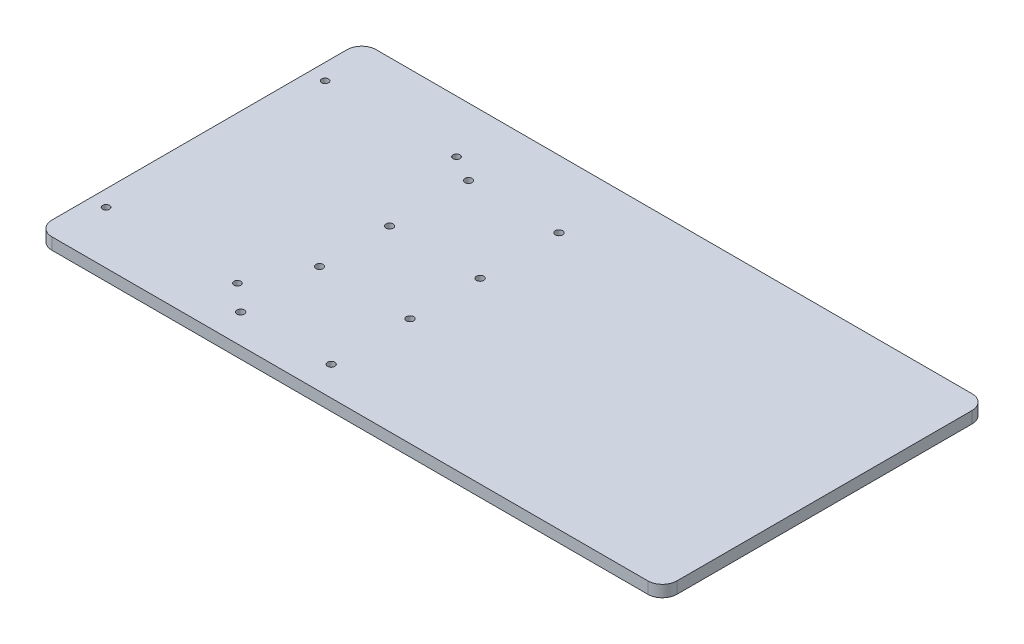
from build123d import *

# Parameters (mm, degrees)
SKETCH1_W           = 214
SKETCH1_H           = 111
BOSS_EXTRUDE1_DEPTH = 4
SKETCH2_R           = 1.172700474
CUT_EXTRUDE1_DEPTH  = 10
CUT_EXTRUDE2_START  = -2.4
SKETCH3_R           = 3.5
SKETCH3_R_2         = 1.172700474
CUT_EXTRUDE2_DEPTH  = 2.4
SKETCH4_R           = 1.6
CUT_EXTRUDE3_DEPTH  = 1.2
FILLET1_R           = 5
CUT_EXTRUDE4_DEPTH  = 8.2


with BuildPart() as part:
    # Sketch1 → Boss-Extrude1 (new body)
    with BuildSketch(Plane(origin=(0, 0, 0), x_dir=(1, 0, 0), z_dir=(0, 1, 0))):
        with Locations((107, 55.5)):
            Rectangle(SKETCH1_W, SKETCH1_H)
    extrude(amount=BOSS_EXTRUDE1_DEPTH)

    # Sketch2 → Cut-Extrude1 (cut)
    with BuildSketch(Plane(origin=(0, 4, 0), x_dir=(1, 0, 0), z_dir=(0, 1, 0))):
        with Locations((5.5, 18)):
            Circle(SKETCH2_R)
        with Locations((5.5, 93)):
            Circle(SKETCH2_R)
        with Locations((50.5, 18)):
            Circle(SKETCH2_R)
        with Locations((50.5, 93)):
            Circle(SKETCH2_R)
    extrude(amount=-CUT_EXTRUDE1_DEPTH, mode=Mode.SUBTRACT)

    # Sketch3 → Cut-Extrude2 (cut)
    # profile 1 of 4: a face of its own
    with BuildSketch(Plane.XZ.offset(CUT_EXTRUDE2_START)):
        with Locations((50.5, -93)):
            Circle(SKETCH3_R)
        with Locations((50.5, -93)):
            Circle(SKETCH3_R_2, mode=Mode.SUBTRACT)
    # profile 2 of 4: a face of its own
    with BuildSketch(Plane.XZ.offset(CUT_EXTRUDE2_START)):
        with Locations((5.5, -93)):
            Circle(SKETCH3_R)
        with Locations((5.5, -93)):
            Circle(SKETCH3_R_2, mode=Mode.SUBTRACT)
    # profile 3 of 4: a face of its own
    with BuildSketch(Plane.XZ.offset(CUT_EXTRUDE2_START)):
        with Locations((5.5, -18)):
            Circle(SKETCH3_R)
        with Locations((5.5, -18)):
            Circle(SKETCH3_R_2, mode=Mode.SUBTRACT)
    # profile 4 of 4: a face of its own
    with BuildSketch(Plane.XZ.offset(CUT_EXTRUDE2_START)):
        with Locations((50.5, -18)):
            Circle(SKETCH3_R)
        with Locations((50.5, -18)):
            Circle(SKETCH3_R_2, mode=Mode.SUBTRACT)
    extrude(amount=CUT_EXTRUDE2_DEPTH, mode=Mode.SUBTRACT)

    # Sketch4 → Cut-Extrude3 (cut)
    with BuildSketch(Plane.XZ):
        with Locations((5, -5)):
            Circle(SKETCH4_R)
        with Locations((5, -106)):
            Circle(SKETCH4_R)
        with Locations((209, -106)):
            Circle(SKETCH4_R)
        with Locations((209, -5)):
            Circle(SKETCH4_R)
    extrude(amount=-CUT_EXTRUDE3_DEPTH, mode=Mode.SUBTRACT)

    # Fillet1
    fillet1_edges = [part.edges().sort_by_distance(p)[0] for p in [
        (214, 2, -111),
        (214, 2, 0),
        (0, 2, 0),
        (0, 2, -111),
    ]]
    fillet(fillet1_edges, radius=FILLET1_R)

    # Sketch5 → Cut-Extrude4 (cut)
    with BuildSketch(Plane(origin=(0, 4, 0), x_dir=(1, 0, 0), z_dir=(0, 1, 0))):
        with BuildLine():
            ThreePointArc((59.5838, 62.25), (58.3338, 61), (59.5838, 59.75))
            ThreePointArc((59.5838, 59.75), (60.8338, 61), (59.5838, 62.25))
        make_face()
        with BuildLine():
            ThreePointArc((59.5838, 89.25), (58.3338, 88), (59.5838, 86.75))
            ThreePointArc((59.5838, 86.75), (60.8338, 88), (59.5838, 89.25))
        make_face()
        with BuildLine():
            ThreePointArc((90.5838, 59.75), (91.8338, 61), (90.5838, 62.25))
            ThreePointArc((90.5838, 62.25), (89.3338, 61), (90.5838, 59.75))
        make_face()
        with BuildLine():
            ThreePointArc((90.5838, 89.25), (89.3338, 88), (90.5838, 86.75))
            ThreePointArc((90.5838, 86.75), (91.8338, 88), (90.5838, 89.25))
        make_face()
        with BuildLine():
            ThreePointArc((90.5838, 35.75), (91.8338, 37), (90.5838, 38.25))
            ThreePointArc((90.5838, 38.25), (89.3338, 37), (90.5838, 35.75))
        make_face()
        with BuildLine():
            ThreePointArc((59.5838, 35.75), (60.8338, 37), (59.5838, 38.25))
            ThreePointArc((59.5838, 38.25), (58.3338, 37), (59.5838, 35.75))
        make_face()
        with BuildLine():
            ThreePointArc((59.5838, 8.75), (60.8338, 10), (59.5838, 11.25))
            ThreePointArc((59.5838, 11.25), (58.3338, 10), (59.5838, 8.75))
        make_face()
        with BuildLine():
            ThreePointArc((90.5838, 8.75), (91.8338, 10), (90.5838, 11.25))
            ThreePointArc((90.5838, 11.25), (89.3338, 10), (90.5838, 8.75))
        make_face()
    extrude(amount=-CUT_EXTRUDE4_DEPTH, mode=Mode.SUBTRACT)


solid = part.part
